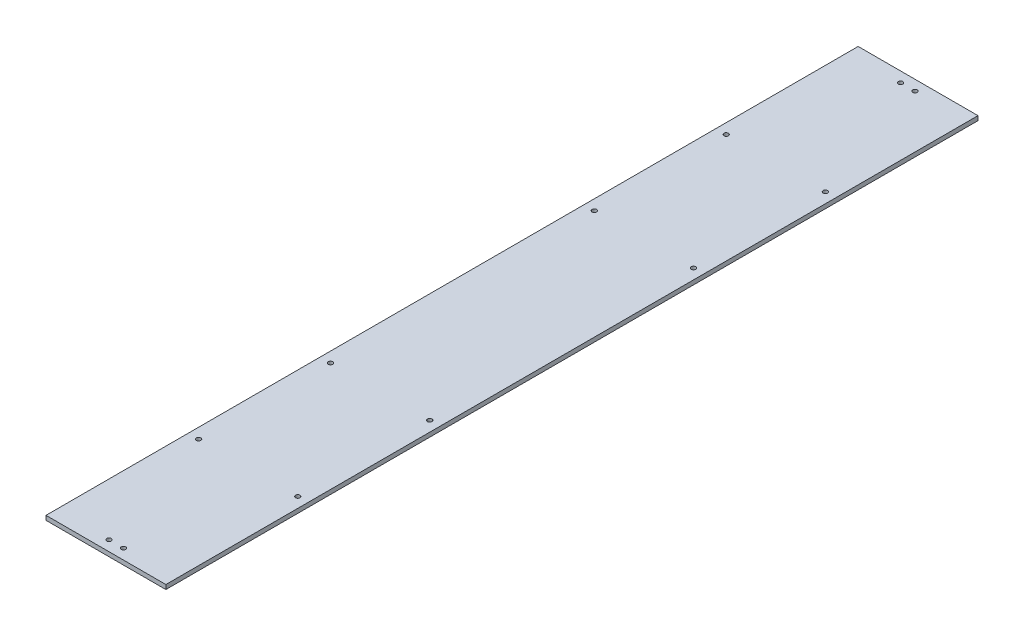
from build123d import *

# Parameters (mm, degrees)
SKETCH1_W           = 87.15
SKETCH1_H           = 590.55
SKETCH1_R           = 1.65
BOSS_EXTRUDE1_DEPTH = 3.175


with BuildPart() as part:
    # Sketch1 → Boss-Extrude1 (new body)
    with BuildSketch(Plane(origin=(0, 0, 0), x_dir=(1, 0, 0), z_dir=(0, 1, 0))):
        Rectangle(SKETCH1_W, SKETCH1_H)
        with Locations((-5.275, 287.775)):
            Circle(SKETCH1_R, mode=Mode.SUBTRACT)
        with Locations((-36.075, 191.848333333)):
            Circle(SKETCH1_R, mode=Mode.SUBTRACT)
        with Locations((-36.075, 95.921666667)):
            Circle(SKETCH1_R, mode=Mode.SUBTRACT)
        with Locations((36.075, 95.921666667)):
            Circle(SKETCH1_R, mode=Mode.SUBTRACT)
        with Locations((36.075, 191.848333333)):
            Circle(SKETCH1_R, mode=Mode.SUBTRACT)
        with Locations((5.275, 287.775)):
            Circle(SKETCH1_R, mode=Mode.SUBTRACT)
        with Locations((5.275, -287.775)):
            Circle(SKETCH1_R, mode=Mode.SUBTRACT)
        with Locations((36.075, -191.848333333)):
            Circle(SKETCH1_R, mode=Mode.SUBTRACT)
        with Locations((36.075, -95.921666667)):
            Circle(SKETCH1_R, mode=Mode.SUBTRACT)
        with Locations((-36.075, -95.921666667)):
            Circle(SKETCH1_R, mode=Mode.SUBTRACT)
        with Locations((-36.075, -191.848333333)):
            Circle(SKETCH1_R, mode=Mode.SUBTRACT)
        with Locations((-5.275, -287.775)):
            Circle(SKETCH1_R, mode=Mode.SUBTRACT)
    extrude(amount=BOSS_EXTRUDE1_DEPTH)


solid = part.part
